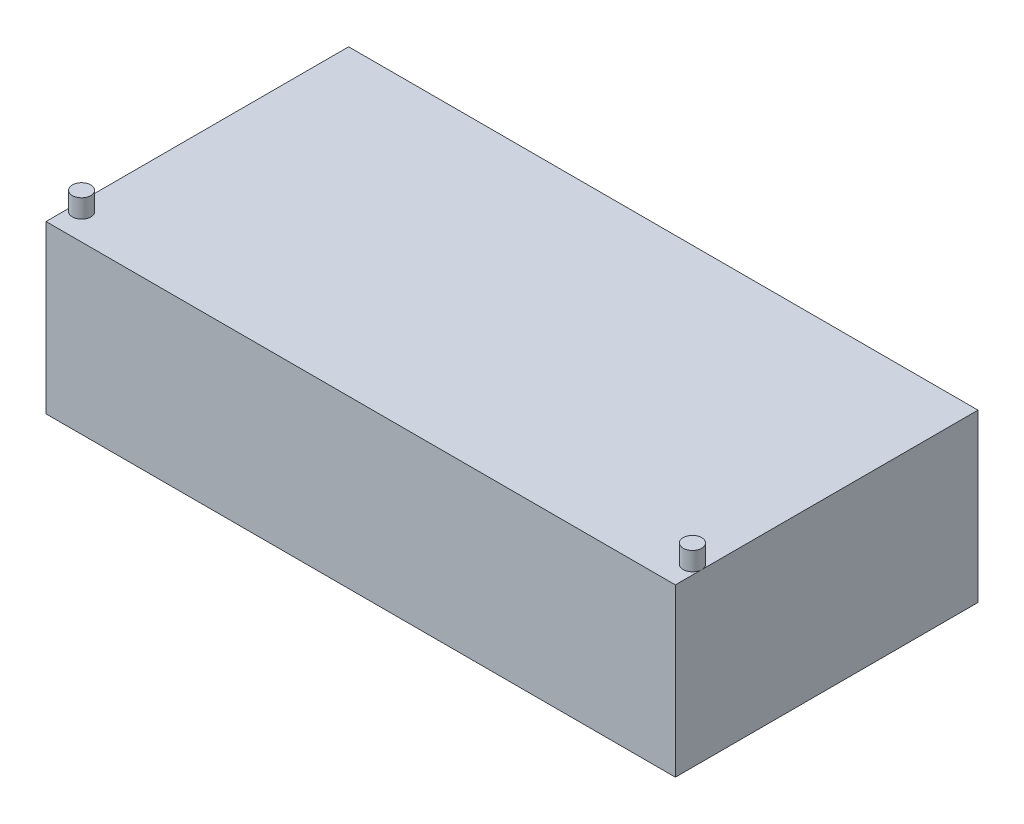
from build123d import *

# Parameters (mm, degrees)
SKETCH1_W           = 340
SKETCH1_H           = 163.5
BOSS_EXTRUDE1_DEPTH = 90
SKETCH2_R           = 5
BOSS_EXTRUDE2_DEPTH = 10


with BuildPart() as part:
    # Sketch1 → Boss-Extrude1 (new body)
    with BuildSketch(Plane(origin=(0, 0, 0), x_dir=(1, 0, 0), z_dir=(0, 1, 0))):
        Rectangle(SKETCH1_W, SKETCH1_H)
    extrude(amount=BOSS_EXTRUDE1_DEPTH)

    # Sketch2 → Boss-Extrude2 (add)
    with BuildSketch(Plane(origin=(0, 90, 0), x_dir=(1, 0, 0), z_dir=(0, 1, 0))):
        with Locations((-165, -67.5)):
            Circle(SKETCH2_R)
        with Locations((165, -67.5)):
            Circle(SKETCH2_R)
    extrude(amount=BOSS_EXTRUDE2_DEPTH)


solid = part.part
